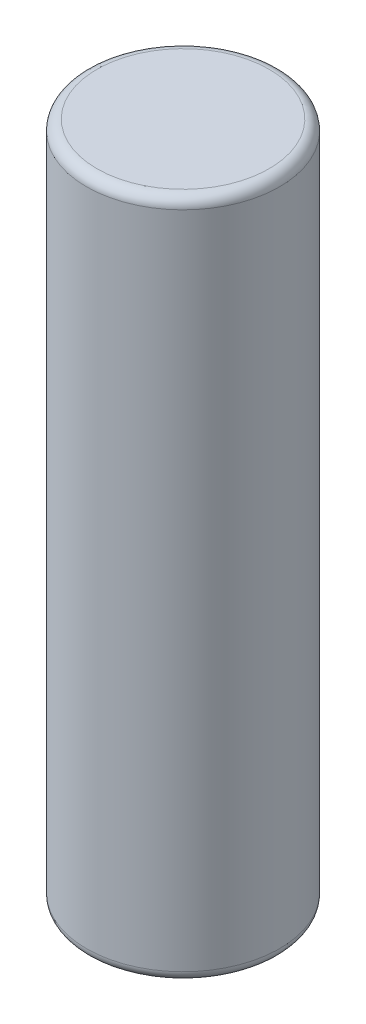
from build123d import *

# Parameters (mm, degrees)
SKETCH1_R           = 9.25
BOSS_EXTRUDE1_DEPTH = 65.2
FILLET2_R           = 1


with BuildPart() as part:
    # Sketch1 → Boss-Extrude1 (new body)
    with BuildSketch(Plane(origin=(0, 0, 0), x_dir=(1, 0, 0), z_dir=(0, 1, 0))):
        Circle(SKETCH1_R)
    extrude(amount=BOSS_EXTRUDE1_DEPTH)

    # Fillet2
    fillet2_edges = [part.edges().sort_by_distance(p)[0] for p in [
        (-9.25, 0, 0),
        (-9.25, 65.2, 0),
    ]]
    fillet(fillet2_edges, radius=FILLET2_R)


solid = part.part
